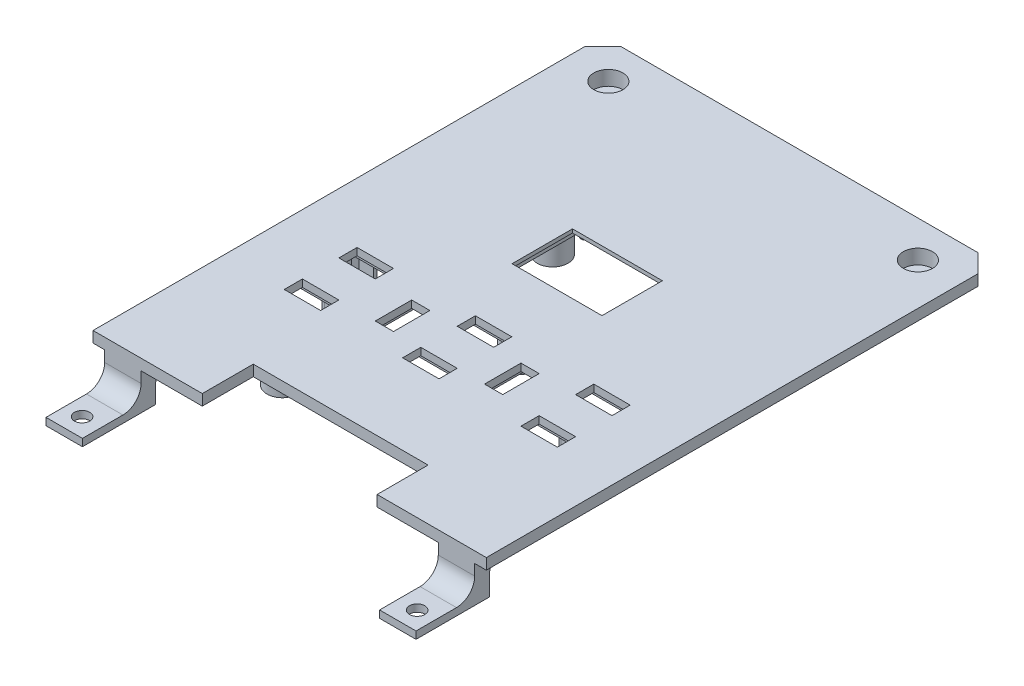
from build123d import *

# Parameters (mm, degrees)
CROQUIS1_R                = 2.1
CROQUIS1_W                = 24.7
CROQUIS1_H                = 16.6
SALIENTE_EXTRUIR1_DEPTH   = 3
CROQUIS2_W                = 27
CROQUIS2_H                = 27
CROQUIS2_R                = 1.25
CORTAR_EXTRUIR1_DEPTH     = 2
CROQUIS3_R                = 4.25
CROQUIS3_R_2              = 2
ALOJAMIENTOINSERTOS_DEPTH = 9
CROQUIS4_W                = 10
CROQUIS4_H                = 5
CROQUIS4_W_2              = 5
CROQUIS4_H_2              = 10
CORTE_BOTONES_DEPTH       = 10
CROQUIS5_W                = 14
CROQUIS5_H                = 8
CROQUIS5_W_2              = 10
CROQUIS5_H_2              = 5
CROQUIS5_W_3              = 8
CROQUIS5_H_3              = 14
CORTAR_EXTRUIR3_DEPTH     = 1
CROQUIS11_W               = 17
CROQUIS11_H               = 11
CROQUIS11_W_2             = 14
CROQUIS11_H_2             = 8
CROQUIS11_W_3             = 11
CROQUIS11_H_3             = 17
CROQUIS11_W_4             = 8
CROQUIS11_H_4             = 14
SALIENTE_EXTRUIR7_DEPTH   = 1
SALIENTE_EXTRUIR8_DEPTH   = 5.5
SALIENTE_EXTRUIR3_DEPTH   = 1.5
CROQUIS7_R                = 5
SALIENTE_EXTRUIR4_DEPTH   = 3
CROQUIS8_R                = 4
CORTAR_EXTRUIR4_DEPTH     = 4
SALIENTE_EXTRUIR5_DEPTH   = 4
CROQUIS10_W               = 10
CROQUIS10_H               = 16.112482534
CROQUIS10_R               = 2.1
SALIENTE_EXTRUIR6_DEPTH   = 2
REDONDEO1_R               = 5


with BuildPart() as part:
    # Croquis1 → Saliente-Extruir1 (new body)
    with BuildSketch(Plane(origin=(0, 0, 0), x_dir=(1, 0, 0), z_dir=(0, 1, 0))):
        Polygon((-54, 65), (-49, 70), (49, 70), (54, 65), (54, -65), (54, -70), (24, -70), (24, -56), (-24, -56), (-24, -70), (-54, -70), (-54, -65), align=None)
        with Locations((-42.5, 60)):
            Circle(CROQUIS1_R, mode=Mode.SUBTRACT)
        with Locations((42.5, 60)):
            Circle(CROQUIS1_R, mode=Mode.SUBTRACT)
        with Locations((0, 11.7)):
            Rectangle(CROQUIS1_W, CROQUIS1_H, mode=Mode.SUBTRACT)
    extrude(amount=SALIENTE_EXTRUIR1_DEPTH)

    # Croquis2 → Cortar-Extruir1 (cut)
    with BuildSketch(Plane.XZ):
        with Locations((0, -11.7)):
            Rectangle(CROQUIS2_W, CROQUIS2_H)
        with Locations((11.7, -23)):
            Circle(CROQUIS2_R, mode=Mode.SUBTRACT)
        with Locations((-11.7, -23)):
            Circle(CROQUIS2_R, mode=Mode.SUBTRACT)
        with Locations((-11.7, -0.4)):
            Circle(CROQUIS2_R, mode=Mode.SUBTRACT)
        with Locations((11.7, -0.4)):
            Circle(CROQUIS2_R, mode=Mode.SUBTRACT)
    extrude(amount=-CORTAR_EXTRUIR1_DEPTH, mode=Mode.SUBTRACT)

    # Croquis3 → AlojamientoInsertos (add)
    # profile 1 of 5: a face of its own
    with BuildSketch(Plane.XZ):
        with Locations((21, -23.2)):
            Circle(CROQUIS3_R)
        with Locations((21, -23.2)):
            Circle(CROQUIS3_R_2, mode=Mode.SUBTRACT)
    # profile 2 of 5: a face of its own
    with BuildSketch(Plane.XZ):
        with Locations((-21, -23.2)):
            Circle(CROQUIS3_R)
        with Locations((-21, -23.2)):
            Circle(CROQUIS3_R_2, mode=Mode.SUBTRACT)
    # profile 3 of 5: a face of its own
    with BuildSketch(Plane.XZ):
        with Locations((-27, 45)):
            Circle(CROQUIS3_R)
        with Locations((-27, 45)):
            Circle(CROQUIS3_R_2, mode=Mode.SUBTRACT)
    # profile 4 of 5: a face of its own
    with BuildSketch(Plane.XZ):
        with Locations((27, 45)):
            Circle(CROQUIS3_R)
        with Locations((27, 45)):
            Circle(CROQUIS3_R_2, mode=Mode.SUBTRACT)
    # profile 5 of 5: a face of its own
    with BuildSketch(Plane.XZ):
        with Locations((0, 7)):
            Circle(CROQUIS3_R)
        with Locations((0, 7)):
            Circle(CROQUIS3_R_2, mode=Mode.SUBTRACT)
    extrude(amount=ALOJAMIENTOINSERTOS_DEPTH)

    # Croquis4 → Corte-Botones (cut)
    with BuildSketch(Plane(origin=(0, 3, 0), x_dir=(1, 0, 0), z_dir=(0, 1, 0))):
        with Locations((0, -31.5)):
            Rectangle(CROQUIS4_W, CROQUIS4_H)
        with Locations((32.5, -16.5)):
            Rectangle(CROQUIS4_W, CROQUIS4_H)
        with Locations((32.5, -31.5)):
            Rectangle(CROQUIS4_W, CROQUIS4_H)
        with Locations((-32.5, -31.5)):
            Rectangle(CROQUIS4_W, CROQUIS4_H)
        with Locations((-32.5, -16.5)):
            Rectangle(CROQUIS4_W, CROQUIS4_H)
        with Locations((0, -16.5)):
            Rectangle(CROQUIS4_W, CROQUIS4_H)
        with Locations((15, -24)):
            Rectangle(CROQUIS4_W_2, CROQUIS4_H_2)
        with Locations((-15, -24)):
            Rectangle(CROQUIS4_W_2, CROQUIS4_H_2)
    extrude(amount=-CORTE_BOTONES_DEPTH, mode=Mode.SUBTRACT)

    # Croquis5 → Cortar-Extruir3 (cut)
    # profile 1 of 8: a face of its own
    with BuildSketch(Plane.XZ):
        with Locations((32.5, 16.5)):
            Rectangle(CROQUIS5_W, CROQUIS5_H)
        with Locations((32.5, 16.5)):
            Rectangle(CROQUIS5_W_2, CROQUIS5_H_2, mode=Mode.SUBTRACT)
    # profile 2 of 8: a face of its own
    with BuildSketch(Plane.XZ):
        with Locations((-32.5, 31.5)):
            Rectangle(CROQUIS5_W, CROQUIS5_H)
        with Locations((-32.5, 31.5)):
            Rectangle(CROQUIS5_W_2, CROQUIS5_H_2, mode=Mode.SUBTRACT)
    # profile 3 of 8: a face of its own
    with BuildSketch(Plane.XZ):
        with Locations((0, 16.5)):
            Rectangle(CROQUIS5_W, CROQUIS5_H)
    # profile 4 of 8: a face of its own
    with BuildSketch(Plane.XZ):
        with Locations((0, 31.5)):
            Rectangle(CROQUIS5_W, CROQUIS5_H)
        with Locations((0, 31.5)):
            Rectangle(CROQUIS5_W_2, CROQUIS5_H_2, mode=Mode.SUBTRACT)
    # profile 5 of 8: a face of its own
    with BuildSketch(Plane.XZ):
        with Locations((-32.5, 16.5)):
            Rectangle(CROQUIS5_W, CROQUIS5_H)
        with Locations((-32.5, 16.5)):
            Rectangle(CROQUIS5_W_2, CROQUIS5_H_2, mode=Mode.SUBTRACT)
    # profile 6 of 8: a face of its own
    with BuildSketch(Plane.XZ):
        with Locations((15, 24)):
            Rectangle(CROQUIS5_W_3, CROQUIS5_H_3)
    # profile 7 of 8: a face of its own
    with BuildSketch(Plane.XZ):
        with Locations((-15, 24)):
            Rectangle(CROQUIS5_W_3, CROQUIS5_H_3)
    # profile 8 of 8: a face of its own
    with BuildSketch(Plane.XZ):
        with Locations((32.5, 31.5)):
            Rectangle(CROQUIS5_W, CROQUIS5_H)
        with Locations((32.5, 31.5)):
            Rectangle(CROQUIS5_W_2, CROQUIS5_H_2, mode=Mode.SUBTRACT)
    extrude(amount=-CORTAR_EXTRUIR3_DEPTH, mode=Mode.SUBTRACT)

    # Croquis11 → Saliente-Extruir7 (add)
    # profile 1 of 8: a face of its own
    with BuildSketch(Plane.XZ):
        with Locations((32.5, 16.5)):
            Rectangle(CROQUIS11_W, CROQUIS11_H)
        with Locations((32.5, 16.5)):
            Rectangle(CROQUIS11_W_2, CROQUIS11_H_2, mode=Mode.SUBTRACT)
    # profile 2 of 8: a face of its own
    with BuildSketch(Plane.XZ):
        with Locations((32.5, 31.5)):
            Rectangle(CROQUIS11_W, CROQUIS11_H)
        with Locations((32.5, 31.5)):
            Rectangle(CROQUIS11_W_2, CROQUIS11_H_2, mode=Mode.SUBTRACT)
    # profile 3 of 8: a face of its own
    with BuildSketch(Plane.XZ):
        with Locations((15, 24)):
            Rectangle(CROQUIS11_W_3, CROQUIS11_H_3)
        with Locations((15, 24)):
            Rectangle(CROQUIS11_W_4, CROQUIS11_H_4, mode=Mode.SUBTRACT)
    # profile 4 of 8: a face of its own
    with BuildSketch(Plane.XZ):
        with Locations((0, 16.5)):
            Rectangle(CROQUIS11_W, CROQUIS11_H)
        with Locations((0, 16.5)):
            Rectangle(CROQUIS11_W_2, CROQUIS11_H_2, mode=Mode.SUBTRACT)
    # profile 5 of 8: a face of its own
    with BuildSketch(Plane.XZ):
        with Locations((-32.5, 16.5)):
            Rectangle(CROQUIS11_W, CROQUIS11_H)
        with Locations((-32.5, 16.5)):
            Rectangle(CROQUIS11_W_2, CROQUIS11_H_2, mode=Mode.SUBTRACT)
    # profile 6 of 8: a face of its own
    with BuildSketch(Plane.XZ):
        with Locations((-15, 24)):
            Rectangle(CROQUIS11_W_3, CROQUIS11_H_3)
        with Locations((-15, 24)):
            Rectangle(CROQUIS11_W_4, CROQUIS11_H_4, mode=Mode.SUBTRACT)
    # profile 7 of 8: a face of its own
    with BuildSketch(Plane.XZ):
        with Locations((-32.5, 31.5)):
            Rectangle(CROQUIS11_W, CROQUIS11_H)
        with Locations((-32.5, 31.5)):
            Rectangle(CROQUIS11_W_2, CROQUIS11_H_2, mode=Mode.SUBTRACT)
    # profile 8 of 8: a face of its own
    with BuildSketch(Plane.XZ):
        with Locations((0, 31.5)):
            Rectangle(CROQUIS11_W, CROQUIS11_H)
        with Locations((0, 31.5)):
            Rectangle(CROQUIS11_W_2, CROQUIS11_H_2, mode=Mode.SUBTRACT)
    extrude(amount=SALIENTE_EXTRUIR7_DEPTH)

    # Croquis12 → Saliente-Extruir8 (add)
    with BuildSketch(Plane.XZ):
        with BuildLine():
            Line((30, 22.5), (35, 22.5))
            ThreePointArc((35, 22.5), (36.5, 24), (35, 25.5))
            Line((35, 25.5), (30, 25.5))
            ThreePointArc((30, 25.5), (28.5, 24), (30, 22.5))
        make_face()
        with BuildLine():
            ThreePointArc((-35, 25.5), (-36.5, 24), (-35, 22.5))
            Line((-35, 22.5), (-30, 22.5))
            ThreePointArc((-30, 22.5), (-28.5, 24), (-30, 25.5))
            Line((-30, 25.5), (-35, 25.5))
        make_face()
        with BuildLine():
            Line((-2.5, 36), (2.5, 36))
            ThreePointArc((2.5, 36), (3.25, 36.75), (2.5, 37.5))
            Line((2.5, 37.5), (-2.5, 37.5))
            ThreePointArc((-2.5, 37.5), (-3.25, 36.75), (-2.5, 36))
        make_face()
        Polygon((35, 11), (41, 11), (41, 17), (40, 17), (40, 13), (39, 12), (35, 12), align=None)
        Polygon((-40, 17), (-41, 17), (-41, 11), (-35, 11), (-35, 12), (-39, 12), (-40, 13), align=None)
        Polygon((40, 31), (41, 31), (41, 37), (35, 37), (35, 36), (39, 36), (40, 35), align=None)
        Polygon((-35, 37), (-41, 37), (-41, 31), (-40, 31), (-40, 35), (-39, 36), (-35, 36), align=None)
    extrude(amount=SALIENTE_EXTRUIR8_DEPTH)

    # Croquis6 → Saliente-Extruir3 (add)
    with BuildSketch(Plane.XZ):
        Polygon((50.8, 70), (50.8, -63.6745166), (47.6745166, -66.8), (-47.6745166, -66.8), (-50.8, -63.6745166), (-50.8, 70), (-49.3, 70), (-49.3, 68.5), (-49.3, -63.053196257), (-47.053196257, -65.3), (47.053196257, -65.3), (49.3, -63.053196257), (49.3, 70), align=None)
    extrude(amount=SALIENTE_EXTRUIR3_DEPTH)

    # Croquis7 → Saliente-Extruir4 (add)
    with BuildSketch(Plane.XZ):
        with Locations((42.5, -60)):
            Circle(CROQUIS7_R)
        with Locations((-42.5, -60)):
            Circle(CROQUIS7_R)
    extrude(amount=SALIENTE_EXTRUIR4_DEPTH)

    # Croquis8 → Cortar-Extruir4 (cut)
    with BuildSketch(Plane(origin=(0, 3, 0), x_dir=(1, 0, 0), z_dir=(0, 1, 0))):
        with Locations((-42.5, 60)):
            Circle(CROQUIS8_R)
        with Locations((42.5, 60)):
            Circle(CROQUIS8_R)
    extrude(amount=-CORTAR_EXTRUIR4_DEPTH, mode=Mode.SUBTRACT)

    # Croquis9 → Saliente-Extruir5 (add)
    with BuildSketch(Plane.XY.offset(70)):
        Polygon((50.8, -1.5), (50.8, -10), (40.8, -10), (40.8, 0), (49.3, 0), (49.3, -1.5), align=None)
        Polygon((-49.3, -1.5), (-50.8, -1.5), (-50.8, -10), (-40.8, -10), (-40.8, 0), (-49.3, 0), align=None)
    extrude(amount=-SALIENTE_EXTRUIR5_DEPTH)

    # Croquis10 → Saliente-Extruir6 (add)
    # profile 1 of 2: a face of its own
    with BuildSketch(Plane.XZ.offset(10)):
        with Locations((45.8, 78.056241267)):
            Rectangle(CROQUIS10_W, CROQUIS10_H)
        with Locations((46, 81)):
            Circle(CROQUIS10_R, mode=Mode.SUBTRACT)
    # profile 2 of 2: a face of its own
    with BuildSketch(Plane.XZ.offset(10)):
        with Locations((-45.8, 78.056241267)):
            Rectangle(CROQUIS10_W, CROQUIS10_H)
        with Locations((-46, 81)):
            Circle(CROQUIS10_R, mode=Mode.SUBTRACT)
    extrude(amount=-SALIENTE_EXTRUIR6_DEPTH)

    # Redondeo1
    redondeo1_edges = [part.edges().sort_by_distance(p)[0] for p in [
        (45.05, 0, 66),
        (45.8, -8, 70),
        (-45.05, 0, 66),
        (-45.8, -8, 70),
    ]]
    fillet(redondeo1_edges, radius=REDONDEO1_R)


solid = part.part
